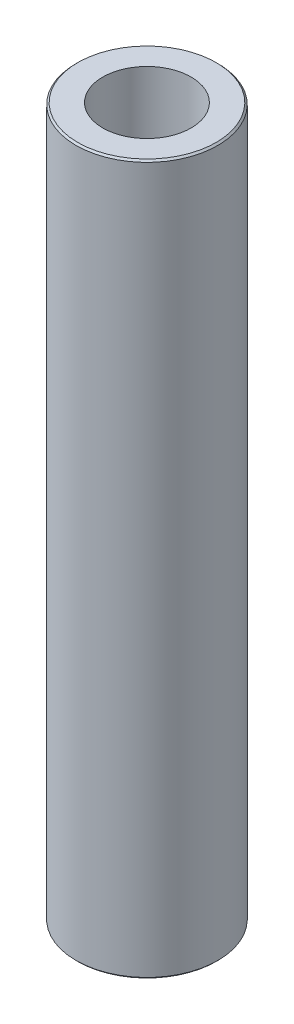
from build123d import *

# Parameters (mm, degrees)
SKETCH1_R           = 60
BOSS_EXTRUDE1_DEPTH = 600
SKETCH2_R           = 37.374223967
CUT_EXTRUDE1_DEPTH  = 606.970296302
CHAMFER1_SIZE       = 1.451089366


with BuildPart() as part:
    # Sketch1 → Boss-Extrude1 (new body)
    with BuildSketch(Plane(origin=(0, 0, 0), x_dir=(1, 0, 0), z_dir=(0, 1, 0))):
        Circle(SKETCH1_R)
    extrude(amount=BOSS_EXTRUDE1_DEPTH)

    # Sketch2 → Cut-Extrude1 (cut, through all)
    with BuildSketch(Plane(origin=(0, 0, 0), x_dir=(1, 0, 0), z_dir=(0, 1, 0))):
        Circle(SKETCH2_R)
    extrude(amount=CUT_EXTRUDE1_DEPTH, mode=Mode.SUBTRACT)

    # Chamfer1
    chamfer1_edges = [part.edges().sort_by_distance(p)[0] for p in [
        (-60, 600, 0),
        (-60, 0, 0),
    ]]
    chamfer(chamfer1_edges, length=CHAMFER1_SIZE)


solid = part.part
